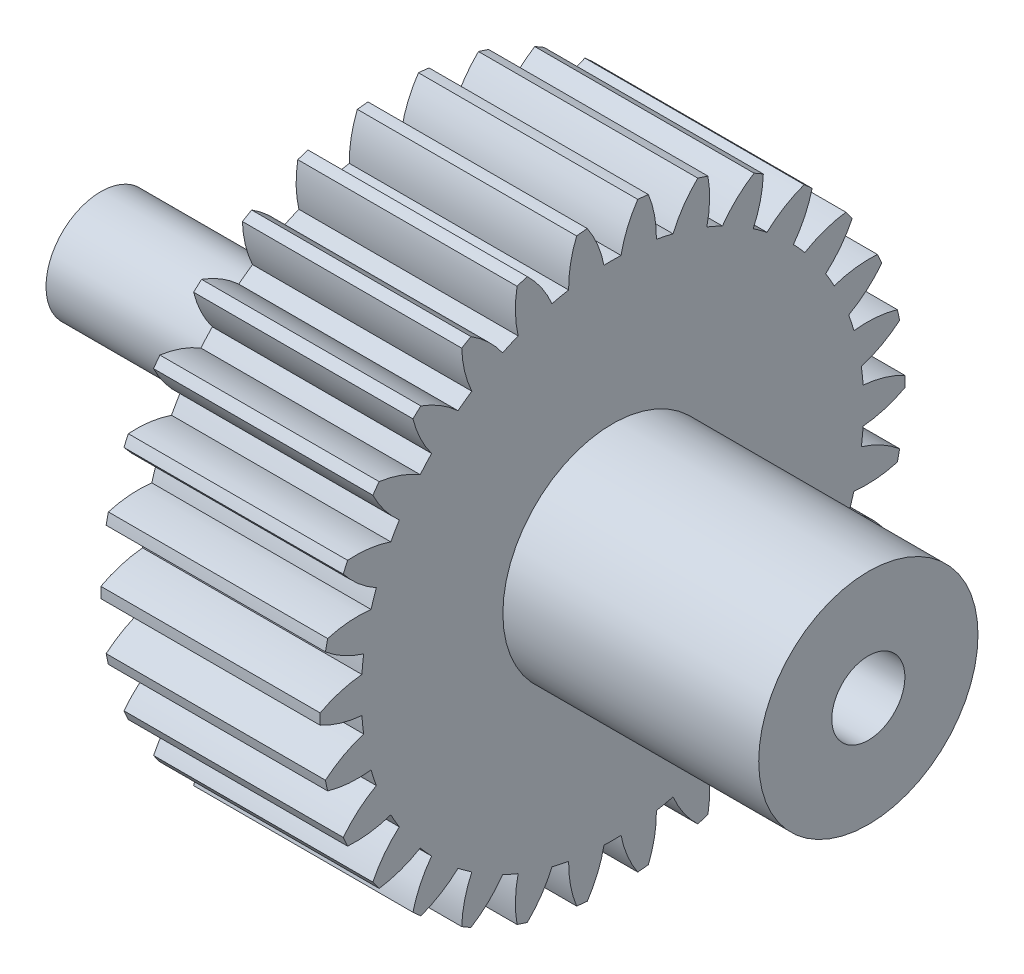
from build123d import *

# Parameters (mm, degrees)
SPUR_GEAR_GB_BORE_OUTLINE_R = 1
SPUR_GEAR_GB_BORE_DEPTH     = 6
SKETCH_2_R                  = 3
SKETCH_2_R_2                = 1
EXTRUDE_1_DEPTH             = 7
SKETCH_3_R                  = 2
EXTRUDE_2_DEPTH             = 6
SKETCH_4_R                  = 1.5
EXTRUDE_3_DEPTH             = 8


# Read off the part's stored shape, not the designer's step: <spur gear_gb>-<Bore>
with BuildPart() as part:
    # <spur gear_gb>-<Bore> outline → <spur gear_gb>-<Bore> (new body)
    with BuildSketch(Plane.YZ):
        with BuildLine():
            ThreePointArc((0.146326846, 7.998661666), (0, 8), (-0.146326846, 7.998661666))
            ThreePointArc((-0.146326846, 7.998661666), (-0.373564224, 7.444765892), (-0.486289788, 6.856777541))
            ThreePointArc((-0.486289788, 6.856777541), (-0.718528657, 6.836343509), (-0.949941023, 6.808045832))
            ThreePointArc((-0.949941023, 6.808045832), (-1.182452915, 7.359748265), (-1.519886018, 7.85429478))
            ThreePointArc((-1.519886018, 7.85429478), (-1.663293526, 7.825180806), (-1.806144524, 7.793448656))
            ThreePointArc((-1.806144524, 7.793448656), (-1.913254814, 7.204411526), (-1.901267401, 6.605835168))
            ThreePointArc((-1.901267401, 6.605835168), (-2.124182819, 6.537562493), (-2.344654853, 6.461769852))
            ThreePointArc((-2.344654853, 6.461769852), (-2.686791187, 6.953074323), (-3.11967257, 7.366657523))
            ThreePointArc((-3.11967257, 7.366657523), (-3.253893145, 7.308363661), (-3.387025021, 7.247624543))
            ThreePointArc((-3.387025021, 7.247624543), (-3.369326988, 6.649189806), (-3.233150506, 6.066186101))
            ThreePointArc((-3.233150506, 6.066186101), (-3.437, 5.953058626), (-3.636896014, 5.833083523))
            ThreePointArc((-3.636896014, 5.833083523), (-4.073703792, 6.242517668), (-4.583114461, 6.557061982))
            ThreePointArc((-4.583114461, 6.557061982), (-4.702282019, 6.472135955), (-4.819876271, 6.385044458))
            ThreePointArc((-4.819876271, 6.385044458), (-4.678143404, 5.803366584), (-4.423729419, 5.261415592))
            ThreePointArc((-4.423729419, 5.261415592), (-4.599603788, 5.10837753), (-4.770187368, 4.949463453))
            ThreePointArc((-4.770187368, 4.949463453), (-5.282575994, 5.259133036), (-5.846252257, 5.460891369))
            ThreePointArc((-5.846252257, 5.460891369), (-5.945158604, 5.353044851), (-6.042075799, 5.243407293))
            ThreePointArc((-6.042075799, 5.243407293), (-5.782502506, 4.703908396), (-5.420970129, 4.226695974))
            ThreePointArc((-5.420970129, 4.226695974), (-5.561182819, 4.040435824), (-5.694998644, 3.84952808))
            ThreePointArc((-5.694998644, 3.84952808), (-6.260574276, 4.045899054), (-6.853880777, 4.126053599))
            ThreePointArc((-6.853880777, 4.126053599), (-6.92820323, 4), (-7.000207622, 3.872608067))
            ThreePointArc((-7.000207622, 3.872608067), (-6.6341385, 3.398866838), (-6.181288432, 3.007249461))
            ThreePointArc((-6.181288432, 3.007249461), (-6.279711476, 2.795907685), (-6.370911152, 2.581349858))
            ThreePointArc((-6.370911152, 2.581349858), (-6.96495542, 2.65583987), (-7.561961817, 2.610887487))
            ThreePointArc((-7.561961817, 2.610887487), (-7.60845213, 2.472135955), (-7.652396782, 2.332557287))
            ThreePointArc((-7.652396782, 2.332557287), (-7.195830808, 1.94527849), (-6.671454769, 1.656371715))
            ThreePointArc((-6.671454769, 1.656371715), (-6.723786607, 1.429184963), (-6.768384272, 1.200354261))
            ThreePointArc((-6.768384272, 1.200354261), (-7.364934592, 1.149707739), (-7.939548841, 0.981613064))
            ThreePointArc((-7.939548841, 0.981613064), (-7.956175163, 0.836227706), (-7.970139481, 0.69056256))
            ThreePointArc((-7.970139481, 0.69056256), (-7.44303078, 0.406672138), (-6.87004652, 0.233102578))
            ThreePointArc((-6.87004652, 0.233102578), (-6.874, 0), (-6.87004652, -0.233102578))
            ThreePointArc((-6.87004652, -0.233102578), (-7.44303078, -0.406672138), (-7.970139481, -0.69056256))
            ThreePointArc((-7.970139481, -0.69056256), (-7.956175163, -0.836227706), (-7.939548841, -0.981613064))
            ThreePointArc((-7.939548841, -0.981613064), (-7.364934592, -1.149707739), (-6.768384272, -1.200354261))
            ThreePointArc((-6.768384272, -1.200354261), (-6.723786607, -1.429184963), (-6.671454769, -1.656371715))
            ThreePointArc((-6.671454769, -1.656371715), (-7.195830808, -1.94527849), (-7.652396782, -2.332557287))
            ThreePointArc((-7.652396782, -2.332557287), (-7.60845213, -2.472135955), (-7.561961817, -2.610887487))
            ThreePointArc((-7.561961817, -2.610887487), (-6.96495542, -2.65583987), (-6.370911152, -2.581349858))
            ThreePointArc((-6.370911152, -2.581349858), (-6.279711476, -2.795907685), (-6.181288432, -3.007249461))
            ThreePointArc((-6.181288432, -3.007249461), (-6.6341385, -3.398866838), (-7.000207622, -3.872608067))
            ThreePointArc((-7.000207622, -3.872608067), (-6.92820323, -4), (-6.853880777, -4.126053599))
            ThreePointArc((-6.853880777, -4.126053599), (-6.260574276, -4.045899054), (-5.694998644, -3.84952808))
            ThreePointArc((-5.694998644, -3.84952808), (-5.561182819, -4.040435824), (-5.420970129, -4.226695974))
            ThreePointArc((-5.420970129, -4.226695974), (-5.782502506, -4.703908396), (-6.042075799, -5.243407293))
            ThreePointArc((-6.042075799, -5.243407293), (-5.945158604, -5.353044851), (-5.846252257, -5.460891369))
            ThreePointArc((-5.846252257, -5.460891369), (-5.282575994, -5.259133036), (-4.770187368, -4.949463453))
            ThreePointArc((-4.770187368, -4.949463453), (-4.599603788, -5.10837753), (-4.423729419, -5.261415592))
            ThreePointArc((-4.423729419, -5.261415592), (-4.678143404, -5.803366584), (-4.819876271, -6.385044458))
            ThreePointArc((-4.819876271, -6.385044458), (-4.702282019, -6.472135955), (-4.583114461, -6.557061982))
            ThreePointArc((-4.583114461, -6.557061982), (-4.073703792, -6.242517668), (-3.636896014, -5.833083523))
            ThreePointArc((-3.636896014, -5.833083523), (-3.437, -5.953058626), (-3.233150506, -6.066186101))
            ThreePointArc((-3.233150506, -6.066186101), (-3.369326988, -6.649189806), (-3.387025021, -7.247624543))
            ThreePointArc((-3.387025021, -7.247624543), (-3.253893145, -7.308363661), (-3.11967257, -7.366657523))
            ThreePointArc((-3.11967257, -7.366657523), (-2.686791187, -6.953074323), (-2.344654853, -6.461769852))
            ThreePointArc((-2.344654853, -6.461769852), (-2.124182819, -6.537562493), (-1.901267401, -6.605835168))
            ThreePointArc((-1.901267401, -6.605835168), (-1.913254814, -7.204411526), (-1.806144524, -7.793448656))
            ThreePointArc((-1.806144524, -7.793448656), (-1.663293526, -7.825180806), (-1.519886018, -7.85429478))
            ThreePointArc((-1.519886018, -7.85429478), (-1.182452915, -7.359748265), (-0.949941023, -6.808045832))
            ThreePointArc((-0.949941023, -6.808045832), (-0.718528657, -6.836343509), (-0.486289788, -6.856777541))
            ThreePointArc((-0.486289788, -6.856777541), (-0.373564224, -7.444765892), (-0.146326846, -7.998661666))
            ThreePointArc((-0.146326846, -7.998661666), (0, -8), (0.146326846, -7.998661666))
            ThreePointArc((0.146326846, -7.998661666), (0.373564224, -7.444765892), (0.486289788, -6.856777541))
            ThreePointArc((0.486289788, -6.856777541), (0.718528657, -6.836343509), (0.949941023, -6.808045832))
            ThreePointArc((0.949941023, -6.808045832), (1.182452915, -7.359748265), (1.519886018, -7.85429478))
            ThreePointArc((1.519886018, -7.85429478), (1.663293526, -7.825180806), (1.806144524, -7.793448656))
            ThreePointArc((1.806144524, -7.793448656), (1.913254814, -7.204411526), (1.901267401, -6.605835168))
            ThreePointArc((1.901267401, -6.605835168), (2.124182819, -6.537562493), (2.344654853, -6.461769852))
            ThreePointArc((2.344654853, -6.461769852), (2.686791187, -6.953074323), (3.11967257, -7.366657523))
            ThreePointArc((3.11967257, -7.366657523), (3.253893145, -7.308363661), (3.387025021, -7.247624543))
            ThreePointArc((3.387025021, -7.247624543), (3.369326988, -6.649189806), (3.233150506, -6.066186101))
            ThreePointArc((3.233150506, -6.066186101), (3.437, -5.953058626), (3.636896014, -5.833083523))
            ThreePointArc((3.636896014, -5.833083523), (4.073703792, -6.242517668), (4.583114461, -6.557061982))
            ThreePointArc((4.583114461, -6.557061982), (4.702282019, -6.472135955), (4.819876271, -6.385044458))
            ThreePointArc((4.819876271, -6.385044458), (4.678143404, -5.803366584), (4.423729419, -5.261415592))
            ThreePointArc((4.423729419, -5.261415592), (4.599603788, -5.10837753), (4.770187368, -4.949463453))
            ThreePointArc((4.770187368, -4.949463453), (5.282575994, -5.259133036), (5.846252257, -5.460891369))
            ThreePointArc((5.846252257, -5.460891369), (5.945158604, -5.353044851), (6.042075799, -5.243407293))
            ThreePointArc((6.042075799, -5.243407293), (5.782502506, -4.703908396), (5.420970129, -4.226695974))
            ThreePointArc((5.420970129, -4.226695974), (5.561182819, -4.040435824), (5.694998644, -3.84952808))
            ThreePointArc((5.694998644, -3.84952808), (6.260574276, -4.045899054), (6.853880777, -4.126053599))
            ThreePointArc((6.853880777, -4.126053599), (6.92820323, -4), (7.000207622, -3.872608067))
            ThreePointArc((7.000207622, -3.872608067), (6.6341385, -3.398866838), (6.181288432, -3.007249461))
            ThreePointArc((6.181288432, -3.007249461), (6.279711476, -2.795907685), (6.370911152, -2.581349858))
            ThreePointArc((6.370911152, -2.581349858), (6.96495542, -2.65583987), (7.561961817, -2.610887487))
            ThreePointArc((7.561961817, -2.610887487), (7.60845213, -2.472135955), (7.652396782, -2.332557287))
            ThreePointArc((7.652396782, -2.332557287), (7.195830808, -1.94527849), (6.671454769, -1.656371715))
            ThreePointArc((6.671454769, -1.656371715), (6.723786607, -1.429184963), (6.768384272, -1.200354261))
            ThreePointArc((6.768384272, -1.200354261), (7.364934592, -1.149707739), (7.939548841, -0.981613064))
            ThreePointArc((7.939548841, -0.981613064), (7.956175163, -0.836227706), (7.970139481, -0.69056256))
            ThreePointArc((7.970139481, -0.69056256), (7.44303078, -0.406672138), (6.87004652, -0.233102578))
            ThreePointArc((6.87004652, -0.233102578), (6.874, 0), (6.87004652, 0.233102578))
            ThreePointArc((6.87004652, 0.233102578), (7.44303078, 0.406672138), (7.970139481, 0.69056256))
            ThreePointArc((7.970139481, 0.69056256), (7.956175163, 0.836227706), (7.939548841, 0.981613064))
            ThreePointArc((7.939548841, 0.981613064), (7.364934592, 1.149707739), (6.768384272, 1.200354261))
            ThreePointArc((6.768384272, 1.200354261), (6.723786607, 1.429184963), (6.671454769, 1.656371715))
            ThreePointArc((6.671454769, 1.656371715), (7.195830808, 1.94527849), (7.652396782, 2.332557287))
            ThreePointArc((7.652396782, 2.332557287), (7.60845213, 2.472135955), (7.561961817, 2.610887487))
            ThreePointArc((7.561961817, 2.610887487), (6.96495542, 2.65583987), (6.370911152, 2.581349858))
            ThreePointArc((6.370911152, 2.581349858), (6.279711476, 2.795907685), (6.181288432, 3.007249461))
            ThreePointArc((6.181288432, 3.007249461), (6.6341385, 3.398866838), (7.000207622, 3.872608067))
            ThreePointArc((7.000207622, 3.872608067), (6.92820323, 4), (6.853880777, 4.126053599))
            ThreePointArc((6.853880777, 4.126053599), (6.260574276, 4.045899054), (5.694998644, 3.84952808))
            ThreePointArc((5.694998644, 3.84952808), (5.561182819, 4.040435824), (5.420970129, 4.226695974))
            ThreePointArc((5.420970129, 4.226695974), (5.782502506, 4.703908396), (6.042075799, 5.243407293))
            ThreePointArc((6.042075799, 5.243407293), (5.945158604, 5.353044851), (5.846252257, 5.460891369))
            ThreePointArc((5.846252257, 5.460891369), (5.282575994, 5.259133036), (4.770187368, 4.949463453))
            ThreePointArc((4.770187368, 4.949463453), (4.599603788, 5.10837753), (4.423729419, 5.261415592))
            ThreePointArc((4.423729419, 5.261415592), (4.678143404, 5.803366584), (4.819876271, 6.385044458))
            ThreePointArc((4.819876271, 6.385044458), (4.702282019, 6.472135955), (4.583114461, 6.557061982))
            ThreePointArc((4.583114461, 6.557061982), (4.073703792, 6.242517668), (3.636896014, 5.833083523))
            ThreePointArc((3.636896014, 5.833083523), (3.437, 5.953058626), (3.233150506, 6.066186101))
            ThreePointArc((3.233150506, 6.066186101), (3.369326988, 6.649189806), (3.387025021, 7.247624543))
            ThreePointArc((3.387025021, 7.247624543), (3.253893145, 7.308363661), (3.11967257, 7.366657523))
            ThreePointArc((3.11967257, 7.366657523), (2.686791187, 6.953074323), (2.344654853, 6.461769852))
            ThreePointArc((2.344654853, 6.461769852), (2.124182819, 6.537562493), (1.901267401, 6.605835168))
            ThreePointArc((1.901267401, 6.605835168), (1.913254814, 7.204411526), (1.806144524, 7.793448656))
            ThreePointArc((1.806144524, 7.793448656), (1.663293526, 7.825180806), (1.519886018, 7.85429478))
            ThreePointArc((1.519886018, 7.85429478), (1.182452915, 7.359748265), (0.949941023, 6.808045832))
            ThreePointArc((0.949941023, 6.808045832), (0.718528657, 6.836343509), (0.486289788, 6.856777541))
            ThreePointArc((0.486289788, 6.856777541), (0.373564224, 7.444765892), (0.146326846, 7.998661666))
        make_face()
        Circle(SPUR_GEAR_GB_BORE_OUTLINE_R, mode=Mode.SUBTRACT)
    extrude(amount=SPUR_GEAR_GB_BORE_DEPTH)

    # 草图2 → 凸台-拉伸1 (add)
    with BuildSketch(Plane(origin=(6, 0, 0), x_dir=(0, 0, -1), z_dir=(1, 0, 0))):
        with Locations(Location((0, 0, 0), (0, 0, 180))):
            Circle(SKETCH_2_R)
        Circle(SKETCH_2_R_2, mode=Mode.SUBTRACT)
    extrude(amount=EXTRUDE_1_DEPTH)

    # 草图3 → 凸台-拉伸2 (add)
    with BuildSketch(Plane.ZY):
        Circle(SKETCH_3_R)
    extrude(amount=-EXTRUDE_2_DEPTH)

    # 草图4 → 凸台-拉伸3 (add)
    with BuildSketch(Plane.ZY):
        with Locations(Location((0, 0, 0), (0, 0, 180))):
            Circle(SKETCH_4_R)
    extrude(amount=EXTRUDE_3_DEPTH)


solid = part.part
